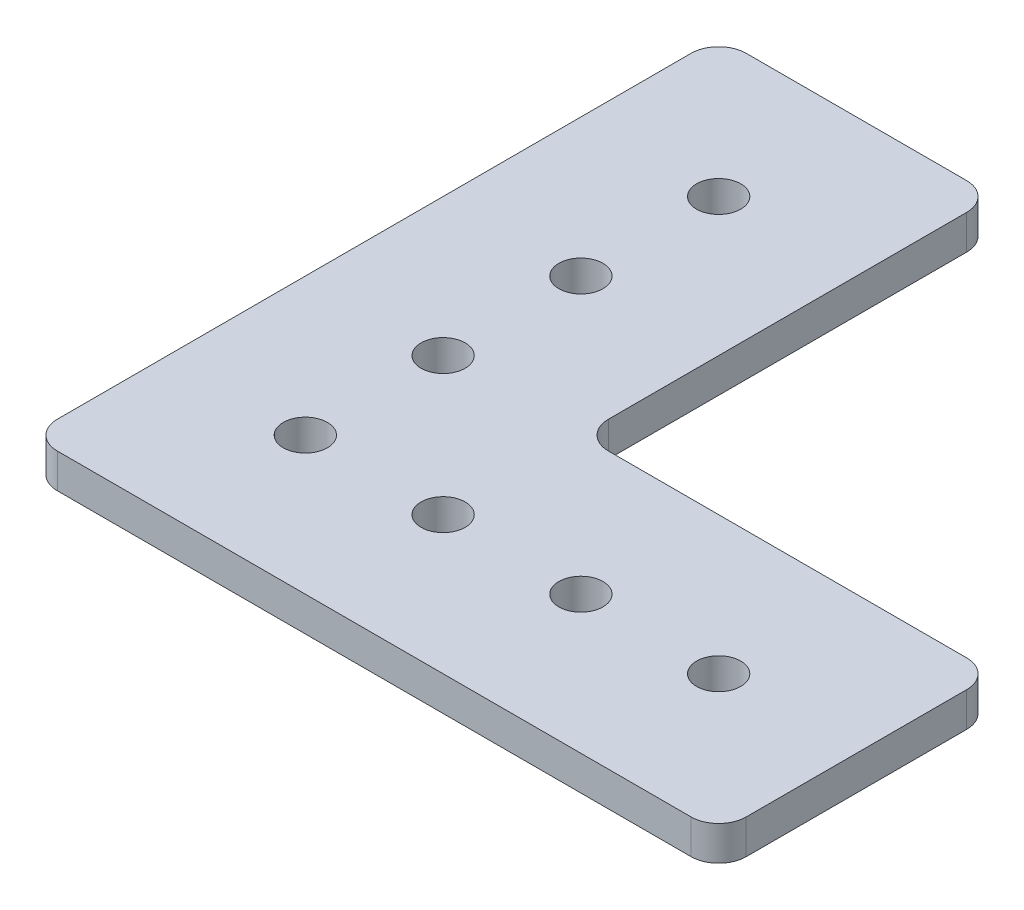
from build123d import *

# Parameters (mm, degrees)
SKETCH1_R           = 2.032
BOSS_EXTRUDE1_DEPTH = 3.175


with BuildPart() as part:
    # Sketch1 → Boss-Extrude1 (new body)
    with BuildSketch(Plane(origin=(0, 0, 0), x_dir=(1, 0, 0), z_dir=(0, 1, 0))):
        with BuildLine():
            ThreePointArc((0, 2.54), (0.743948776, 0.743948776), (2.54, 0))
            Line((2.54, 0), (25.4, 0))
            Line((25.4, 0), (60.96, 0))
            ThreePointArc((60.96, 0), (62.756051224, 0.743948776), (63.5, 2.54))
            Line((63.5, 2.54), (63.5, 22.86))
            ThreePointArc((63.5, 22.86), (62.756051224, 24.656051224), (60.96, 25.4))
            Line((60.96, 25.4), (27.94, 25.4))
            ThreePointArc((27.94, 25.4), (26.143948776, 26.143948776), (25.4, 27.94))
            Line((25.4, 27.94), (25.4, 60.96))
            ThreePointArc((25.4, 60.96), (24.656051224, 62.756051224), (22.86, 63.5))
            Line((22.86, 63.5), (2.54, 63.5))
            ThreePointArc((2.54, 63.5), (0.743948776, 62.756051224), (0, 60.96))
            Line((0, 60.96), (0, 25.4))
            Line((0, 25.4), (0, 2.54))
        make_face()
        with Locations((12.7, 12.7)):
            Circle(SKETCH1_R, mode=Mode.SUBTRACT)
        with Locations((25.4, 12.7)):
            Circle(SKETCH1_R, mode=Mode.SUBTRACT)
        with Locations((12.7, 25.4)):
            Circle(SKETCH1_R, mode=Mode.SUBTRACT)
        with Locations((38.1, 12.7)):
            Circle(SKETCH1_R, mode=Mode.SUBTRACT)
        with Locations((50.8, 12.7)):
            Circle(SKETCH1_R, mode=Mode.SUBTRACT)
        with Locations((12.7, 38.1)):
            Circle(SKETCH1_R, mode=Mode.SUBTRACT)
        with Locations((12.7, 50.8)):
            Circle(SKETCH1_R, mode=Mode.SUBTRACT)
    extrude(amount=BOSS_EXTRUDE1_DEPTH)


solid = part.part
